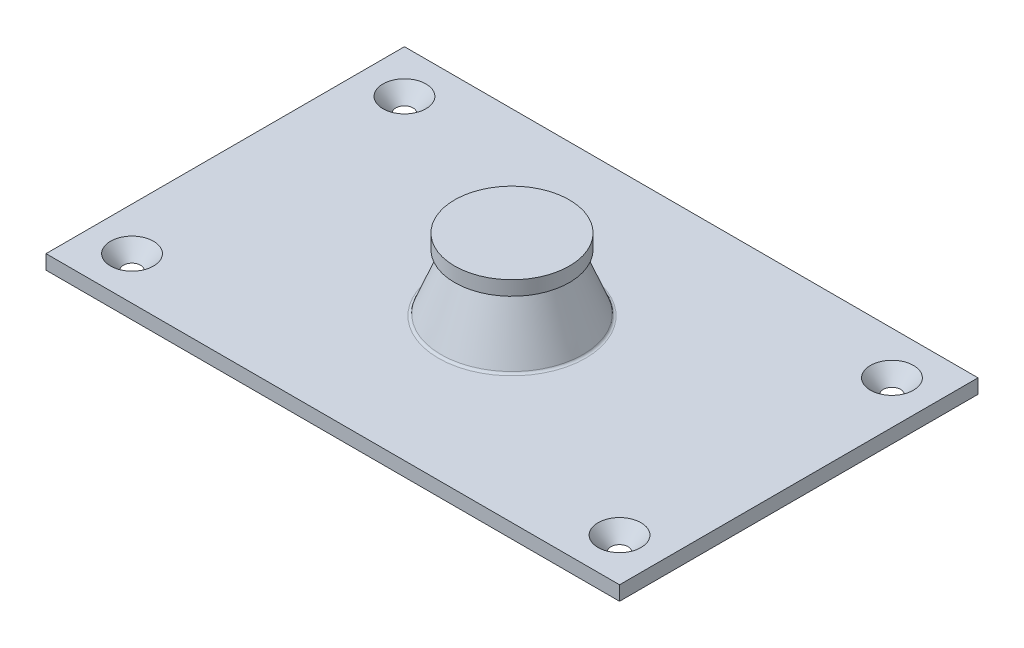
from build123d import *

# Parameters (mm, degrees)
SKETCH1_W                = 50.8
SKETCH1_H                = 31.75
BOSS_EXTRUDE1_DEPTH      = 1.27
BOSS_EXTRUDE2_DEPTH      = 6.35
BOSS_EXTRUDE2_DEPTH_BACK = 1.27
SKETCH2_R                = 6.35
CHAMFER1_SIZE            = 6.35
CHAMFER1_SIZE_2          = 2.54
FILLET1_R                = 0.254
SKETCH7_R                = 5.08
BOSS_EXTRUDE3_DEPTH      = 1.27


with BuildPart() as part:
    # Sketch1 → Boss-Extrude1 (new body)
    with BuildSketch(Plane(origin=(0, 0, 0), x_dir=(1, 0, 0), z_dir=(0, 1, 0))):
        Rectangle(SKETCH1_W, SKETCH1_H)
    extrude(amount=BOSS_EXTRUDE1_DEPTH)

    # Sketch2 → Boss-Extrude2 (add, two sides: drawn at the far end of the back side and taken through both)
    with BuildSketch(Plane(origin=(0, 1.27, 0), x_dir=(1, 0, 0), z_dir=(0, 1, 0)).offset(-BOSS_EXTRUDE2_DEPTH_BACK)):
        with Locations(Location((0, 0, 0), (0, 0, 270))):
            Circle(SKETCH2_R)
    extrude(amount=BOSS_EXTRUDE2_DEPTH + BOSS_EXTRUDE2_DEPTH_BACK)

    # Chamfer1
    # the kernel refuses this chamfer: 6.35, 2.54 mm, written as the material it takes off along each edge
    with BuildSketch(Plane(origin=(0, 7.62, 0), x_dir=(0, 0, 1), z_dir=(-1, 0, 0))) as chamfer1_piece_1_section:
        Polygon((6.35, -CHAMFER1_SIZE), (6.35 - CHAMFER1_SIZE_2, 0), (6.35, 0), align=None)
    chamfer1_piece_1 = revolve(axis=Axis((0, 7.62, 0), (0, 1, 0)), mode=Mode.PRIVATE)
    chamfer1_piece_1 = split(chamfer1_piece_1, bisect_by=Plane(origin=(0, 1.27, -5.09685111), z_dir=(0, 1, 0)), keep=Keep.TOP, mode=Mode.PRIVATE)
    add(chamfer1_piece_1, mode=Mode.SUBTRACT)

    # Fillet1
    fillet1_edges = [part.edges().sort_by_distance(p)[0] for p in [
        (0, 1.27, -6.35),
    ]]
    fillet(fillet1_edges, radius=FILLET1_R)

    # Sketch6 → Cut-Revolve1 (revolve, cut)
    with BuildSketch(Plane.XY.offset(12.065), mode=Mode.PRIVATE) as cut_revolve1_sk:
        Polygon((21.59, 1.27), (21.59, 0), (20.828, 0), (19.685, 1.27), align=None)
    cut_revolve1 = revolve(cut_revolve1_sk.sketch.rotate(Axis((21.59, 1.27, 12.065), (0, -1, 0)), 270), axis=Axis((21.59, 1.27, 12.065), (0, -1, 0)), mode=Mode.SUBTRACT)

    # Mirror1: Cut-Revolve1 across plane
    add(cut_revolve1.mirror(Plane.XY), mode=Mode.SUBTRACT)

    # Mirror2: Cut-Revolve1 across plane
    add(cut_revolve1.mirror(Plane(origin=(0, 0, 0), x_dir=(0, 0, 1), z_dir=(1, 0, 0))), mode=Mode.SUBTRACT)

    # Mirror2 copy 1 sketch → Mirror2 copy 1 (revolve, cut)
    with BuildSketch(Plane(origin=(0, 0, -12.065), x_dir=(-1, 0, 0), z_dir=(0, 0, -1))):
        Polygon((21.59, 1.27), (21.59, 0), (20.828, 0), (19.685, 1.27), align=None)
    revolve(axis=Axis((-21.59, 1.27, -12.065), (0, -1, 0)), mode=Mode.SUBTRACT)

    # Sketch7 → Boss-Extrude3 (add)
    with BuildSketch(Plane(origin=(0, 7.62, 0), x_dir=(1, 0, 0), z_dir=(0, 1, 0))):
        with Locations(Location((0, 0, 0), (0, 0, 270))):
            Circle(SKETCH7_R)
    extrude(amount=-BOSS_EXTRUDE3_DEPTH)


solid = part.part
